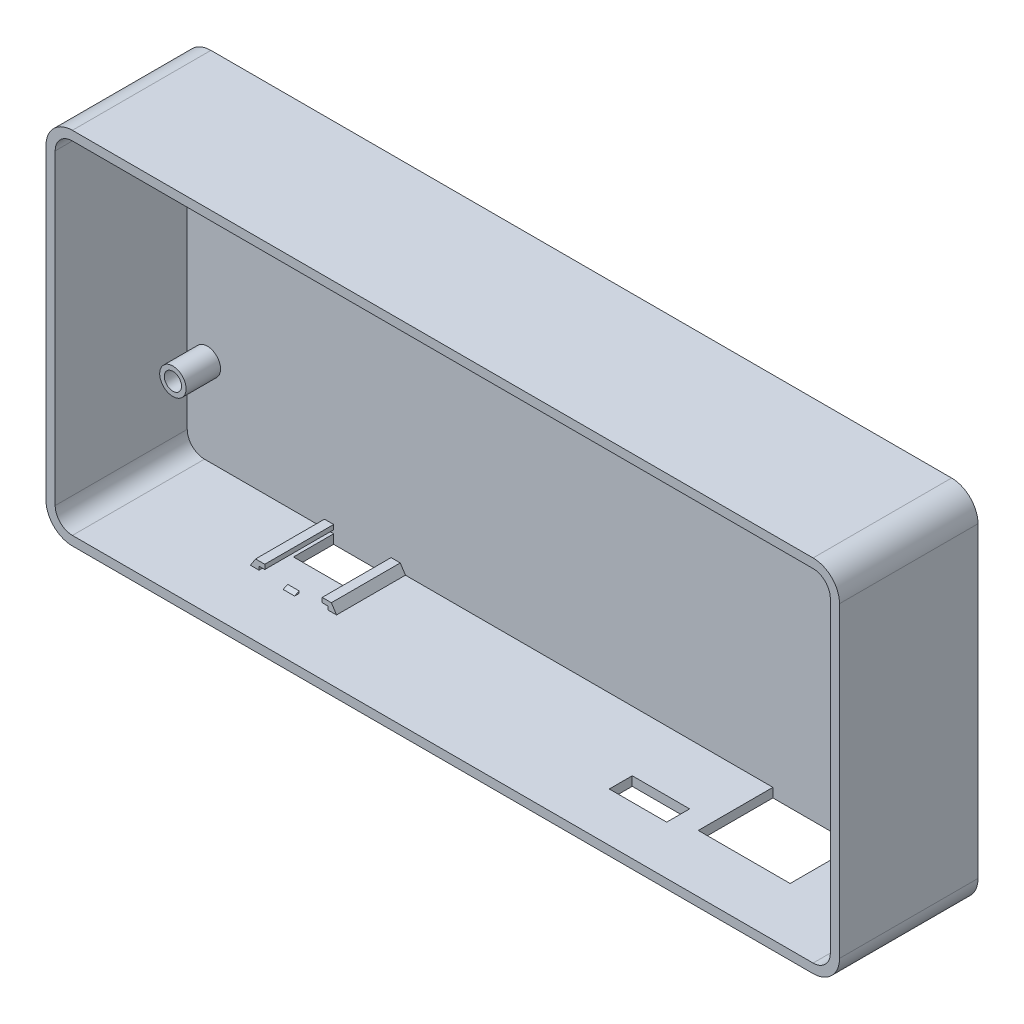
from build123d import *

# Parameters (mm, degrees)
PARED_DEPTH             = 23
CONECTORES_REACH        = 154.052
CROQUIS2_W              = 16
CROQUIS2_H              = 13
CROQUIS2_W_2            = 10
CROQUIS2_H_2            = 4
CROQUIS2_H_3            = 7
BASE_START              = -1.12
BASE_FRENTE_DEPTH       = 1.12
LUCES_REACH             = 153.399
CROQUIS3_R              = 1.5
CROQUIS3_R_2            = 2.5
SALIENTE_EXTRUIR1_START = 12
CROQUIS3_3_R            = 2.3
CROQUIS3_3_R_2          = 1.5
SALIENTE_EXTRUIR1_DEPTH = 12
SALIENTE_EXTRUIR2_START = 9
CROQUIS3_4_R            = 3.3
CROQUIS3_4_R_2          = 2.5
SALIENTE_EXTRUIR2_DEPTH = 9
SALIENTE_EXTRUIR3_START = 6
CROQUIS3_5_R            = 2.3
CROQUIS3_5_R_2          = 1.5
SALIENTE_EXTRUIR3_DEPTH = 6
SALIENTE_EXTRUIR4_DEPTH = 12
CROQUIS5_W              = 2
CROQUIS5_H              = 0.8
SALIENTE_EXTRUIR5_DEPTH = 0.4
CHAFL_N1_SIZE           = 0.4
CHAFL_N1_SIZE_2         = 0.857802768


with BuildPart() as part:
    # Croquis1 → pared (new body)
    with BuildSketch(Plane.XY):
        with BuildLine():
            Line((3, 61.1), (132, 61.1))
            ThreePointArc((132, 61.1), (135.252691193, 59.752691193), (136.6, 56.5))
            Line((136.6, 56.5), (136.6, 3))
            ThreePointArc((136.6, 3), (135.252691193, -0.252691193), (132, -1.6))
            Line((132, -1.6), (3, -1.6))
            ThreePointArc((3, -1.6), (-0.252691193, -0.252691193), (-1.6, 3))
            Line((-1.6, 3), (-1.6, 56.5))
            ThreePointArc((-1.6, 56.5), (-0.252691193, 59.752691193), (3, 61.1))
        make_face()
        with BuildLine():
            Line((3, 0), (132, 0))
            ThreePointArc((132, 0), (134.121320344, 0.878679656), (135, 3))
            Line((135, 3), (135, 56.5))
            ThreePointArc((135, 56.5), (134.121320344, 58.621320344), (132, 59.5))
            Line((132, 59.5), (3, 59.5))
            ThreePointArc((3, 59.5), (0.878679656, 58.621320344), (0, 56.5))
            Line((0, 56.5), (0, 3))
            ThreePointArc((0, 3), (0.878679656, 0.878679656), (3, 0))
        make_face(mode=Mode.SUBTRACT)
    extrude(amount=PARED_DEPTH)

    # Croquis2 → conectores (cut, up to next)
    with BuildSketch(Plane.XZ.offset(1.6), mode=Mode.PRIVATE) as conectores_sk1:
        with Locations((110, 6.5)):
            Rectangle(CROQUIS2_W, CROQUIS2_H)
    conectores_tool1 = extrude(conectores_sk1.sketch, amount=-CONECTORES_REACH, mode=Mode.PRIVATE) & part.part
    # Croquis2 → conectores (cut, up to next)
    with BuildSketch(Plane.XZ.offset(1.6), mode=Mode.PRIVATE) as conectores_sk2:
        with Locations((93, 12.5)):
            Rectangle(CROQUIS2_W_2, CROQUIS2_H_2)
    conectores_tool2 = extrude(conectores_sk2.sketch, amount=-CONECTORES_REACH, mode=Mode.PRIVATE) & part.part
    # Croquis2 → conectores (cut, up to next)
    with BuildSketch(Plane.XZ.offset(1.6), mode=Mode.PRIVATE) as conectores_sk3:
        with Locations((30.5, 3.5)):
            Rectangle(CROQUIS2_W_2, CROQUIS2_H_3)
    conectores_tool3 = extrude(conectores_sk3.sketch, amount=-CONECTORES_REACH, mode=Mode.PRIVATE) & part.part
    add(conectores_tool1.solids().sort_by_distance((110, -1.6, 6.5))[0], mode=Mode.SUBTRACT)
    add(conectores_tool2.solids().sort_by_distance((93, -1.6, 12.5))[0], mode=Mode.SUBTRACT)
    add(conectores_tool3.solids().sort_by_distance((30.5, -1.6, 3.5))[0], mode=Mode.SUBTRACT)

    # Croquis1<2> → base frente (add)
    with BuildSketch(Plane.XY.offset(BASE_START)):
        with BuildLine():
            Line((3, 61.1), (132, 61.1))
            ThreePointArc((132, 61.1), (135.252691193, 59.752691193), (136.6, 56.5))
            Line((136.6, 56.5), (136.6, 3))
            ThreePointArc((136.6, 3), (135.252691193, -0.252691193), (132, -1.6))
            Line((132, -1.6), (3, -1.6))
            ThreePointArc((3, -1.6), (-0.252691193, -0.252691193), (-1.6, 3))
            Line((-1.6, 3), (-1.6, 56.5))
            ThreePointArc((-1.6, 56.5), (-0.252691193, 59.752691193), (3, 61.1))
        make_face()
    extrude(amount=BASE_FRENTE_DEPTH)

    # Croquis3 → luces (cut, up to next)
    with BuildSketch(Plane.XY, mode=Mode.PRIVATE) as luces_sk1:
        with Locations((130.5, 48)):
            Circle(CROQUIS3_R)
    luces_tool1 = extrude(luces_sk1.sketch, amount=-LUCES_REACH, mode=Mode.PRIVATE) & part.part
    # Croquis3 → luces (cut, up to next)
    with BuildSketch(Plane.XY, mode=Mode.PRIVATE) as luces_sk2:
        with Locations((130.5, 41.5)):
            Circle(CROQUIS3_R)
    luces_tool2 = extrude(luces_sk2.sketch, amount=-LUCES_REACH, mode=Mode.PRIVATE) & part.part
    # Croquis3 → luces (cut, up to next)
    with BuildSketch(Plane.XY, mode=Mode.PRIVATE) as luces_sk3:
        with Locations((130.5, 35)):
            Circle(CROQUIS3_R)
    luces_tool3 = extrude(luces_sk3.sketch, amount=-LUCES_REACH, mode=Mode.PRIVATE) & part.part
    # Croquis3 → luces (cut, up to next)
    with BuildSketch(Plane.XY, mode=Mode.PRIVATE) as luces_sk4:
        with Locations((130.5, 28.5)):
            Circle(CROQUIS3_R)
    luces_tool4 = extrude(luces_sk4.sketch, amount=-LUCES_REACH, mode=Mode.PRIVATE) & part.part
    # Croquis3 → luces (cut, up to next)
    with BuildSketch(Plane.XY, mode=Mode.PRIVATE) as luces_sk5:
        with Locations((130.5, 17.5)):
            Circle(CROQUIS3_R)
    luces_tool5 = extrude(luces_sk5.sketch, amount=-LUCES_REACH, mode=Mode.PRIVATE) & part.part
    # Croquis3 → luces (cut, up to next)
    with BuildSketch(Plane.XY, mode=Mode.PRIVATE) as luces_sk6:
        with Locations((130.5, 11.5)):
            Circle(CROQUIS3_R_2)
    luces_tool6 = extrude(luces_sk6.sketch, amount=-LUCES_REACH, mode=Mode.PRIVATE) & part.part
    # Croquis3 → luces (cut, up to next)
    with BuildSketch(Plane.XY, mode=Mode.PRIVATE) as luces_sk7:
        with Locations((3.5, 15)):
            Circle(CROQUIS3_R)
    luces_tool7 = extrude(luces_sk7.sketch, amount=-LUCES_REACH, mode=Mode.PRIVATE) & part.part
    add(luces_tool1.solids().sort_by_distance((130.5, 48, 0))[0], mode=Mode.SUBTRACT)
    add(luces_tool2.solids().sort_by_distance((130.5, 41.5, 0))[0], mode=Mode.SUBTRACT)
    add(luces_tool3.solids().sort_by_distance((130.5, 35, 0))[0], mode=Mode.SUBTRACT)
    add(luces_tool4.solids().sort_by_distance((130.5, 28.5, 0))[0], mode=Mode.SUBTRACT)
    add(luces_tool5.solids().sort_by_distance((130.5, 17.5, 0))[0], mode=Mode.SUBTRACT)
    add(luces_tool6.solids().sort_by_distance((130.5, 11.5, 0))[0], mode=Mode.SUBTRACT)
    add(luces_tool7.solids().sort_by_distance((3.5, 15, 0))[0], mode=Mode.SUBTRACT)

    # Croquis3<3> → Saliente-Extruir1 (add)
    # profile 1 of 5: a face of its own
    with BuildSketch(Plane.XY.offset(SALIENTE_EXTRUIR1_START)):
        with Locations((130.5, 17.5)):
            Circle(CROQUIS3_3_R)
        with Locations((130.5, 17.5)):
            Circle(CROQUIS3_3_R_2, mode=Mode.SUBTRACT)
    # profile 2 of 5: a face of its own
    with BuildSketch(Plane.XY.offset(SALIENTE_EXTRUIR1_START)):
        with Locations((130.5, 28.5)):
            Circle(CROQUIS3_3_R)
        with Locations((130.5, 28.5)):
            Circle(CROQUIS3_3_R_2, mode=Mode.SUBTRACT)
    # profile 3 of 5: a face of its own
    with BuildSketch(Plane.XY.offset(SALIENTE_EXTRUIR1_START)):
        with Locations((130.5, 35)):
            Circle(CROQUIS3_3_R)
        with Locations((130.5, 35)):
            Circle(CROQUIS3_3_R_2, mode=Mode.SUBTRACT)
    # profile 4 of 5: a face of its own
    with BuildSketch(Plane.XY.offset(SALIENTE_EXTRUIR1_START)):
        with Locations((130.5, 41.5)):
            Circle(CROQUIS3_3_R)
        with Locations((130.5, 41.5)):
            Circle(CROQUIS3_3_R_2, mode=Mode.SUBTRACT)
    # profile 5 of 5: a face of its own
    with BuildSketch(Plane.XY.offset(SALIENTE_EXTRUIR1_START)):
        with Locations((130.5, 48)):
            Circle(CROQUIS3_3_R)
        with Locations((130.5, 48)):
            Circle(CROQUIS3_3_R_2, mode=Mode.SUBTRACT)
    extrude(amount=-SALIENTE_EXTRUIR1_DEPTH)

    # Croquis3<4> → Saliente-Extruir2 (add)
    with BuildSketch(Plane.XY.offset(SALIENTE_EXTRUIR2_START)):
        with Locations((130.5, 11.5)):
            Circle(CROQUIS3_4_R)
        with Locations((130.5, 11.5)):
            Circle(CROQUIS3_4_R_2, mode=Mode.SUBTRACT)
    extrude(amount=-SALIENTE_EXTRUIR2_DEPTH)

    # Croquis3<5> → Saliente-Extruir3 (add)
    with BuildSketch(Plane.XY.offset(SALIENTE_EXTRUIR3_START)):
        with Locations((3.5, 15)):
            Circle(CROQUIS3_5_R)
        with Locations((3.5, 15)):
            Circle(CROQUIS3_5_R_2, mode=Mode.SUBTRACT)
    extrude(amount=-SALIENTE_EXTRUIR3_DEPTH)

    # Croquis4 → Saliente-Extruir4 (add)
    with BuildSketch(Plane.XY):
        Polygon((36.5, 0), (36.5, 0.6), (35.5, 0.6), (35.5, 1.4), (37.1, 1.4), (38, 0), align=None)
        Polygon((24.5, 0), (23, 0), (23.9, 1.4), (25.5, 1.4), (25.5, 0.6), (24.5, 0.6), align=None)
    extrude(amount=SALIENTE_EXTRUIR4_DEPTH)

    # Croquis5 → Saliente-Extruir5 (add)
    with BuildSketch(Plane(origin=(0, 0, 0), x_dir=(1, 0, 0), z_dir=(0, 1, 0))):
        with Locations((30.5, -12.4)):
            Rectangle(CROQUIS5_W, CROQUIS5_H)
    extrude(amount=SALIENTE_EXTRUIR5_DEPTH)

    # Chaflán1
    # the kernel refuses this chamfer: 0.857802768, 0.4 mm, written as the material it takes off along each edge
    with BuildSketch(Plane(origin=(27.277454068, 0.4, 12.8), x_dir=(0, -0.9971975577536771, 0.07481330637060238), z_dir=(1, 0, 0))) as chafl_n1_piece_1_section:
        Polygon((CHAFL_N1_SIZE * 0.997197557754, CHAFL_N1_SIZE * 0.0748133063706), (-CHAFL_N1_SIZE_2 * 0.0748133063884, CHAFL_N1_SIZE_2 * 0.997197557991), (0, 0), align=None)
    chafl_n1_piece_1 = extrude(amount=6.445091863, mode=Mode.PRIVATE)
    chafl_n1_piece_1 = split(chafl_n1_piece_1, bisect_by=Plane(origin=(30.5, 0, 12.509130299), z_dir=(0, 1, 0)), keep=Keep.TOP, mode=Mode.PRIVATE)
    add(chafl_n1_piece_1, mode=Mode.SUBTRACT)


solid = part.part
